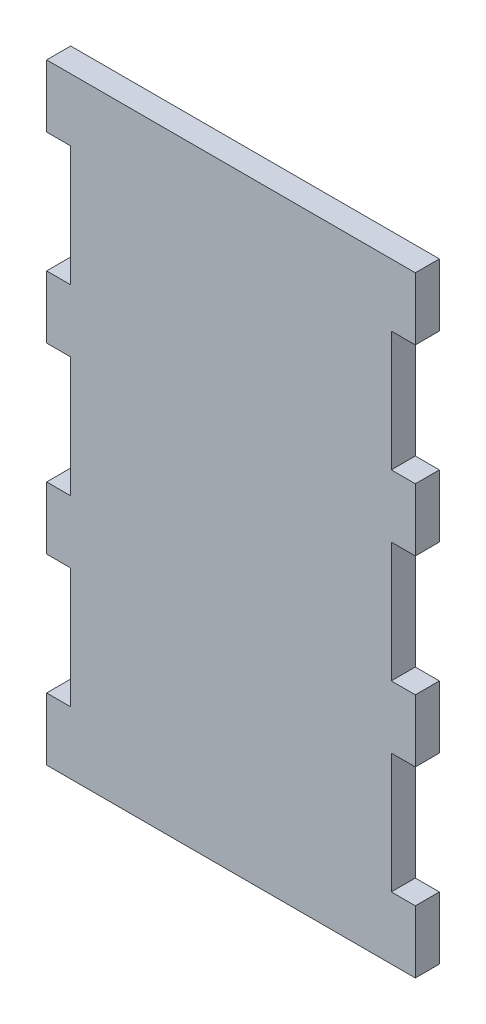
from build123d import *

# Parameters (mm, degrees)
SKETCH1_W           = 46
SKETCH1_H           = 76.2
BOSS_EXTRUDE1_DEPTH = 3
SKETCH2_W           = 3
SKETCH2_H           = 15
CUT_EXTRUDE1_DEPTH  = 73.446802019
LPATTERN1_COUNT     = 3
LPATTERN1_PITCH     = 22.8


with BuildPart() as part:
    # Sketch1 → Boss-Extrude1 (new body)
    with BuildSketch(Plane.XY):
        with Locations((-17.993460648, -21.557986111)):
            Rectangle(SKETCH1_W, SKETCH1_H)
    extrude(amount=BOSS_EXTRUDE1_DEPTH)

    # Sketch2 → Cut-Extrude1 (cut, through all)
    with BuildSketch(Plane.XY.offset(3)):
        with Locations((-39.493460648, 1.242013889)):
            Rectangle(SKETCH2_W, SKETCH2_H)
        with Locations((3.506539352, 1.242013889)):
            Rectangle(SKETCH2_W, SKETCH2_H)
    cut_extrude1 = extrude(amount=-CUT_EXTRUDE1_DEPTH, mode=Mode.SUBTRACT)

    # LPattern1: Cut-Extrude1 ×3
    with Locations(*[(0, -i * LPATTERN1_PITCH, 0) for i in range(1, LPATTERN1_COUNT)]):
        add(cut_extrude1, mode=Mode.SUBTRACT)


solid = part.part
